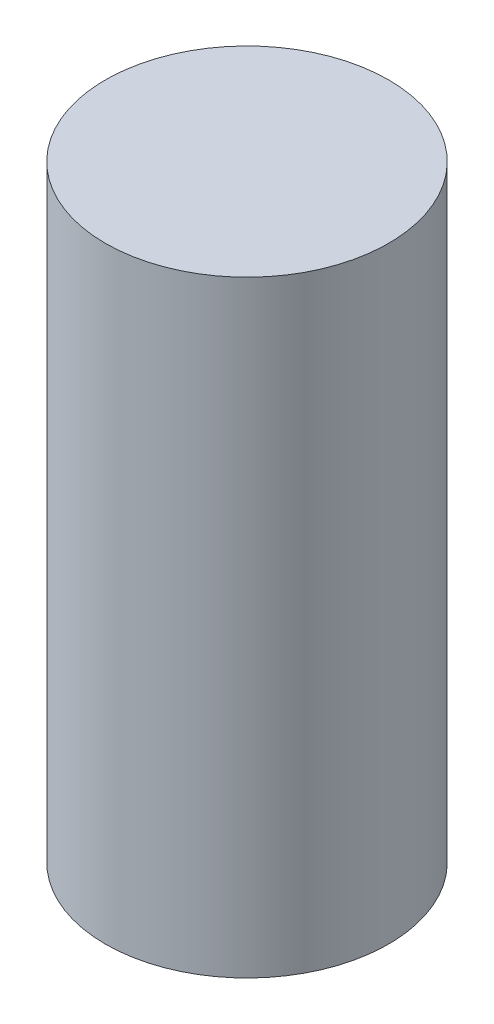
from build123d import *

# Parameters (mm, degrees)
SKETCH1_R           = 35
BOSS_EXTRUDE1_DEPTH = 150


with BuildPart() as part:
    # Sketch1 → Boss-Extrude1 (new body)
    with BuildSketch(Plane(origin=(0, 0, 0), x_dir=(1, 0, 0), z_dir=(0, 1, 0))):
        Circle(SKETCH1_R)
    extrude(amount=BOSS_EXTRUDE1_DEPTH)


solid = part.part
